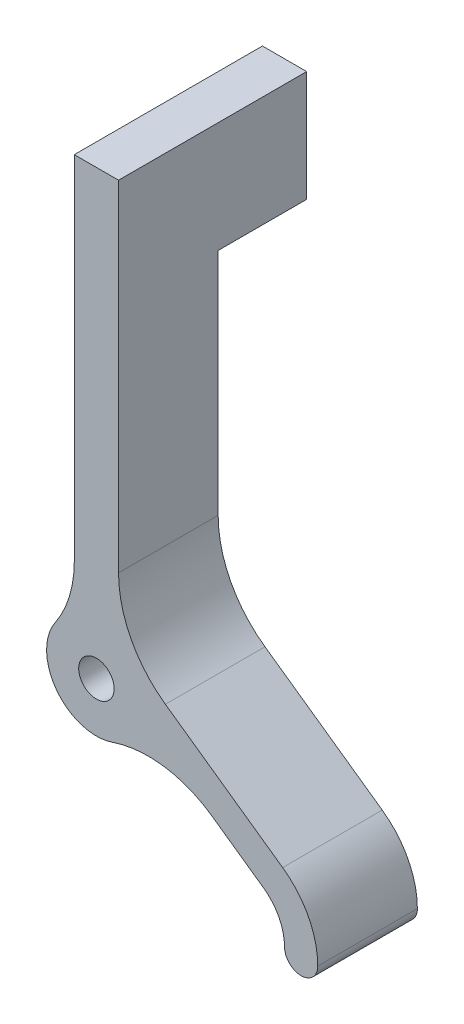
from build123d import *

# Parameters (mm, degrees)
SKETCH1_R           = 1.6
BOSS_EXTRUDE1_DEPTH = 9
FILLET1_R           = 10
SKETCH2_W           = 4
SKETCH2_H           = 10
BOSS_EXTRUDE2_DEPTH = 8


with BuildPart() as part:
    # Sketch1 → Boss-Extrude1 (new body)
    with BuildSketch(Plane.XY):
        with BuildLine():
            Line((2.59582525, 3.67582525), (16.826375417, -6.373624583))
            ThreePointArc((16.826375417, -6.373624583), (19.159497565, -9.050204037), (20, -12.5))
            ThreePointArc((20, -12.5), (18.5, -14), (17, -12.5))
            ThreePointArc((17, -12.5), (16.495698539, -10.430122422), (15.09582525, -8.82417475))
            Line((15.09582525, -8.82417475), (4.330876365, -1.222092433))
            ThreePointArc((4.330876365, -1.222092433), (-2.873556974, -3.463043505), (-2, 4.031128874))
            Line((-2, 4.031128874), (-2, 40))
            Line((-2, 40), (2, 40))
            Line((2, 40), (2, 4.031128874))
            ThreePointArc((2, 4.031128874), (2.304769533, 3.864975731), (2.59582525, 3.67582525))
        make_face()
        Circle(SKETCH1_R, mode=Mode.SUBTRACT)
    extrude(amount=BOSS_EXTRUDE1_DEPTH)

    # Fillet1
    fillet1_edges = [part.edges().sort_by_distance(p)[0] for p in [
        (4.330876365, -1.222092433, 4.5),
        (-2, 4.031128874, 4.5),
        (2, 4.031128874, 4.5),
    ]]
    fillet(fillet1_edges, radius=FILLET1_R)

    # Sketch2 → Boss-Extrude2 (add)
    with BuildSketch(Plane(origin=(0, 0, 0), x_dir=(-1, 0, 0), z_dir=(0, 0, -1))):
        with Locations((0, 35)):
            Rectangle(SKETCH2_W, SKETCH2_H)
    extrude(amount=BOSS_EXTRUDE2_DEPTH)


solid = part.part
